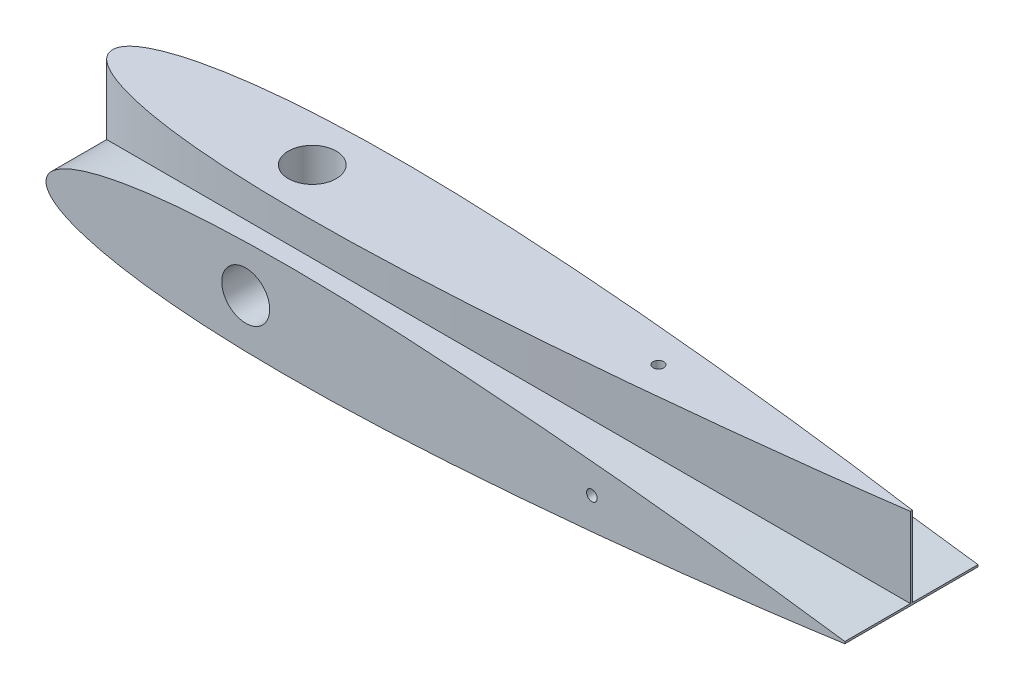
from build123d import *

# Parameters (mm, degrees)
BOSS_EXTRUDE1_DEPTH = 50
BOSS_EXTRUDE2_DEPTH = 30
SKETCH13_R          = 9
SKETCH13_R_2        = 2
CUT_EXTRUDE8_DEPTH  = 20
SKETCH7_R           = 9
SKETCH7_R_2         = 2
CUT_EXTRUDE7_DEPTH  = 308.408523106


with BuildPart() as part:
    # Sketch5 → Boss-Extrude1 (new body)
    with BuildSketch(Plane.XY):
        with BuildLine():
            Line((300, 0), (300, -0.756041962))
            add(Edge.make_bspline(
                [(300, 0), (299.270365927, 0.101451452), (297.234513604, 0.384525096), (293.659298238, 0.879722332), (289.111807476, 1.496325492), (284.07993306, 2.166637693), (278.750864845, 2.860281068), (273.264415139, 3.557143865), (267.704162982, 4.251255897), (262.112460178, 4.935343029), (256.505934894, 5.604502875), (250.889013227, 6.260338272), (245.266519137, 6.904162431), (239.643995458, 7.534650953), (234.021468154, 8.149444358), (228.395113675, 8.748715337), (222.763970876, 9.335595752), (217.1313214, 9.910009837), (211.500498238, 10.469522165), (205.872395515, 11.014254142), (200.245975807, 11.543525315), (194.620571747, 12.057286284), (188.996636207, 12.554608618), (183.375057998, 13.035821098), (177.756440831, 13.499125932), (172.14120509, 13.944011117), (166.530121591, 14.370618519), (160.924017172, 14.777048303), (155.323678997, 15.161942377), (149.729197986, 15.525511264), (144.14003771, 15.864726646), (138.556719148, 16.18031859), (132.981589915, 16.470311694), (127.417860753, 16.733140405), (121.867732906, 16.966833414), (116.330564521, 17.168209686), (110.804975644, 17.335641286), (105.290466593, 17.467467421), (99.789457992, 17.563066602), (94.306019377, 17.619568363), (88.844044449, 17.633103134), (83.406626568, 17.602210802), (77.996159127, 17.52213323), (72.615835045, 17.38999897), (67.269821711, 17.202368703), (61.964153383, 16.954456498), (56.707187731, 16.643956427), (51.511383659, 16.26386075), (46.394126937, 15.813066251), (41.379822078, 15.284517424), (36.501046317, 14.676778377), (31.804123982, 13.988399992), (27.351032213, 13.226209768), (23.219856049, 12.405271964), (19.487073369, 11.542891407), (16.202520011, 10.667189849), (13.373277604, 9.797620045), (10.968887473, 8.955995793), (8.94540731, 8.14451492), (7.251043844, 7.369385019), (5.829725371, 6.632993767), (4.631317476, 5.92296277), (3.611785056, 5.228803878), (2.735410361, 4.548887725), (1.989717136, 3.872132171), (1.37401174, 3.192436679), (0.884398863, 2.513081734), (0.512653331, 1.842321526), (0.243842413, 1.188524902), (0.06906583, 0.553066625), (-0.020161024, -0.069022816), (-0.020161024, -0.687019146), (0.06906583, -1.309108586), (0.243842413, -1.944566864), (0.512653331, -2.598363488), (0.884398863, -3.269123696), (1.37401174, -3.948478641), (1.989717136, -4.628174133), (2.735410361, -5.304929687), (3.611785056, -5.98484584), (4.631317476, -6.679004732), (5.829725371, -7.38903573), (7.251043845, -8.125426978), (8.945407307, -8.900556895), (10.968887484, -9.712037691), (13.373277554, -10.55366231), (16.202520248, -11.423230391), (19.487072279, -12.298939898), (23.219860895, -13.161284893), (27.350994941, -13.982372213), (31.804189553, -14.743931684), (36.501009866, -15.432962661), (41.379828218, -16.040519171), (46.394125242, -16.569119316), (51.511384123, -17.019899669), (56.707187605, -17.399999218), (61.964153418, -17.710498235), (67.269821701, -17.958410726), (72.615835048, -18.146040916), (77.996159127, -18.278175196), (83.406626568, -18.358252762), (88.844044449, -18.389145096), (94.306019377, -18.375610325), (99.789457992, -18.319108564), (105.290466593, -18.223509383), (110.804975644, -18.091683248), (116.330564521, -17.924251648), (121.867732906, -17.722875376), (127.417860753, -17.489182366), (132.981589915, -17.226353656), (138.556719148, -16.936360552), (144.14003771, -16.620768608), (149.729197986, -16.281553226), (155.323678997, -15.917984339), (160.924017172, -15.533090265), (166.530121591, -15.126660481), (172.14120509, -14.700053079), (177.756440831, -14.255167894), (183.375057998, -13.79186306), (188.996636207, -13.31065058), (194.620571747, -12.813328246), (200.245975807, -12.299567277), (205.872395515, -11.770296104), (211.500498238, -11.225564127), (217.1313214, -10.666051799), (222.763970876, -10.091637714), (228.395113675, -9.504757299), (234.021468154, -8.90548632), (239.643995458, -8.290692915), (245.266519137, -7.660204393), (250.889013227, -7.016380234), (256.505934894, -6.360544837), (262.112460178, -5.691384991), (267.704162982, -5.007297859), (273.264415139, -4.313185827), (278.750864845, -3.61632303), (284.07993306, -2.922679655), (289.111807476, -2.252367454), (293.659298238, -1.635764294), (297.234513604, -1.140567058), (299.270365927, -0.857493414), (300, -0.756041962)],
                knots=[0, 0, 0, 0, 0.003612221, 0.010078953, 0.017698618, 0.026115111, 0.034970966, 0.04405038, 0.05323433, 0.06244757, 0.071673993, 0.080921319, 0.090177538, 0.099424342, 0.108664441, 0.117912199, 0.127169502, 0.136426595, 0.145675426, 0.154916495, 0.164153237, 0.173386649, 0.182615736, 0.191838089, 0.201053134, 0.210260393, 0.219458942, 0.228646747, 0.237822316, 0.246985224, 0.256137384, 0.265279416, 0.27440695, 0.283512193, 0.292591781, 0.301646285, 0.310681793, 0.319699068, 0.32869452, 0.33766016, 0.346588583, 0.355477412, 0.364322937, 0.373121614, 0.381867635, 0.390553005, 0.399166026, 0.407689628, 0.416098119, 0.424354887, 0.432412429, 0.440204728, 0.447630505, 0.454563638, 0.460855379, 0.466413319, 0.47122861, 0.475365774, 0.47890126, 0.481915077, 0.484498872, 0.486747127, 0.488741252, 0.490543179, 0.492182104, 0.493672831, 0.495031908, 0.49627906, 0.497424737, 0.498490166, 0.499502758, 0.500497254, 0.501509846, 0.502575275, 0.503720952, 0.504968104, 0.506327181, 0.507817908, 0.509456832, 0.51125876, 0.513252884, 0.51550114, 0.518084934, 0.521098752, 0.524634237, 0.528771401, 0.533586692, 0.539144632, 0.545436374, 0.552369506, 0.5597952, 0.567587571, 0.575645113, 0.583901881, 0.592310372, 0.600833974, 0.609446995, 0.618132365, 0.626878386, 0.635677063, 0.644522588, 0.653411417, 0.66233984, 0.67130548, 0.680300932, 0.689318207, 0.698353715, 0.707408219, 0.716487807, 0.72559305, 0.734720584, 0.743862616, 0.753014776, 0.762177684, 0.771353253, 0.780541058, 0.789739607, 0.798946866, 0.808161911, 0.817384264, 0.826613351, 0.835846763, 0.845083505, 0.854324574, 0.863573405, 0.872830498, 0.882087801, 0.891335559, 0.900575658, 0.909822462, 0.919078681, 0.928326007, 0.93755243, 0.94676567, 0.95594962, 0.965029034, 0.973884889, 0.982301382, 0.989921047, 0.996387779, 1, 1, 1, 1], degree=3))
        make_face()
    extrude(amount=BOSS_EXTRUDE1_DEPTH)

    # Sketch10 → Boss-Extrude2 (add)
    with BuildSketch(Plane(origin=(0, 0, 0), x_dir=(1, 0, 0), z_dir=(0, 1, 0))):
        with BuildLine():
            Line((300, -24.621999914), (300, -25.378000086))
            add(Edge.make_bspline(
                [(300, -24.621999914), (299.270406258, -24.52055407), (297.234666467, -24.237496073), (293.659648722, -23.742326209), (289.112409325, -23.125757132), (284.080813047, -22.455481982), (278.752039398, -21.761876949), (273.265892957, -21.065052672), (267.705948145, -20.370979007), (262.114554424, -19.686929688), (256.508339042, -19.01780683), (250.891727853, -18.362007685), (245.269544548, -17.718219113), (239.647331656, -17.087765441), (234.025115138, -16.473006019), (228.399071658, -15.873768166), (222.768240123, -15.28692019), (217.135901993, -14.712537856), (211.505390076, -14.153056455), (205.877598449, -13.608354589), (200.251489743, -13.079112671), (194.626396629, -12.565380101), (189.002771954, -12.068085257), (183.381504479, -11.586899375), (177.763197883, -11.123620151), (172.148272526, -10.678759557), (166.537499181, -10.252175736), (160.931704642, -9.845768418), (155.331676028, -9.460895619), (149.737504253, -9.097346828), (144.148652919, -8.758150196), (138.565642978, -8.442575697), (132.990821912, -8.152598622), (127.427400287, -7.889784439), (121.877579225, -7.656104347), (116.340716908, -7.454739206), (110.81543346, -7.287316861), (105.301229225, -7.155498013), (99.800524694, -7.059904117), (94.317389178, -7.003405478), (88.855716162, -6.989871456), (83.418598836, -7.020762081), (78.008430461, -7.100835226), (72.628403778, -7.232962182), (67.282685946, -7.420582078), (61.977310891, -7.668480579), (56.72063582, -7.978963487), (51.525118947, -8.359038155), (46.408145083, -8.809807736), (41.394117392, -9.338327347), (36.515611307, -9.946032801), (31.818948595, -10.634373136), (27.366102973, -11.39652123), (23.235155161, -12.217413656), (19.502578811, -13.079746544), (16.218207008, -13.955399698), (13.389120989, -14.824921436), (10.984863761, -15.666499167), (8.961495446, -16.477935185), (7.267225637, -17.253022241), (5.845985727, -17.989372788), (4.647644075, -18.699364538), (3.62816801, -19.39348506), (2.751841757, -20.073363631), (2.006189751, -20.750081777), (1.390518388, -21.429739698), (0.900932575, -22.109057092), (0.52920759, -22.779780223), (0.260411531, -23.433540709), (0.085644609, -24.068963861), (-0.003577313, -24.691018915), (-0.003577313, -25.308981085), (0.085644609, -25.931036139), (0.260411531, -26.566459291), (0.52920759, -27.220219777), (0.900932575, -27.890942908), (1.390518388, -28.570260302), (2.006189751, -29.249918223), (2.751841757, -29.926636369), (3.62816801, -30.60651494), (4.647644075, -31.300635462), (5.845985727, -32.010627213), (7.267225637, -32.746977757), (8.961495444, -33.522064829), (10.984863772, -34.333500769), (13.389120938, -35.175078867), (16.218207245, -36.044598882), (19.502577721, -36.920259984), (23.235160006, -37.782557313), (27.366065703, -38.603599247), (31.819014163, -39.365116623), (36.515574857, -40.054109513), (41.394123531, -40.66163244), (46.408143388, -41.190203367), (51.525119412, -41.640958803), (56.720635693, -42.021037342), (61.977310926, -42.331519196), (67.282685937, -42.579417983), (72.628403781, -42.767037802), (78.008430461, -42.899164778), (83.418598837, -42.979237918), (88.855716162, -43.010128544), (94.317389178, -42.996594522), (99.800524694, -42.940095883), (105.301229225, -42.844501987), (110.81543346, -42.712683139), (116.340716908, -42.545260794), (121.877579225, -42.343895653), (127.427400287, -42.110215561), (132.990821912, -41.847401378), (138.565642978, -41.557424303), (144.148652919, -41.241849804), (149.737504253, -40.902653172), (155.331676028, -40.539104381), (160.931704642, -40.154231582), (166.537499181, -39.747824264), (172.148272526, -39.321240443), (177.763197883, -38.876379849), (183.381504479, -38.413100625), (189.002771954, -37.931914743), (194.626396629, -37.434619899), (200.251489743, -36.920887329), (205.877598449, -36.391645411), (211.505390076, -35.846943545), (217.135901993, -35.287462144), (222.768240123, -34.71307981), (228.399071658, -34.126231834), (234.025115138, -33.526993981), (239.647331656, -32.912234559), (245.269544548, -32.281780887), (250.891727853, -31.637992315), (256.508339042, -30.98219317), (262.114554424, -30.313070312), (267.705948145, -29.629020993), (273.265892957, -28.934947328), (278.752039398, -28.238123051), (284.080813047, -27.544518018), (289.112409325, -26.874242868), (293.659648722, -26.257673791), (297.234666467, -25.762503927), (299.270406258, -25.47944593), (300, -25.378000086)],
                knots=[0, 0, 0, 0, 0.003612221, 0.010078953, 0.017698618, 0.026115111, 0.034970966, 0.04405038, 0.05323433, 0.06244757, 0.071673993, 0.080921319, 0.090177538, 0.099424342, 0.108664441, 0.117912199, 0.127169502, 0.136426595, 0.145675426, 0.154916495, 0.164153237, 0.173386649, 0.182615736, 0.191838089, 0.201053134, 0.210260393, 0.219458942, 0.228646747, 0.237822316, 0.246985224, 0.256137384, 0.265279416, 0.27440695, 0.283512193, 0.292591781, 0.301646285, 0.310681793, 0.319699068, 0.32869452, 0.33766016, 0.346588583, 0.355477412, 0.364322937, 0.373121614, 0.381867635, 0.390553005, 0.399166026, 0.407689628, 0.416098119, 0.424354887, 0.432412429, 0.440204728, 0.447630505, 0.454563638, 0.460855379, 0.466413319, 0.47122861, 0.475365774, 0.47890126, 0.481915077, 0.484498872, 0.486747127, 0.488741252, 0.490543179, 0.492182104, 0.493672831, 0.495031908, 0.49627906, 0.497424737, 0.498490166, 0.499502758, 0.500497254, 0.501509846, 0.502575275, 0.503720952, 0.504968104, 0.506327181, 0.507817908, 0.509456832, 0.51125876, 0.513252884, 0.51550114, 0.518084934, 0.521098752, 0.524634237, 0.528771401, 0.533586692, 0.539144632, 0.545436374, 0.552369506, 0.5597952, 0.567587571, 0.575645113, 0.583901881, 0.592310372, 0.600833974, 0.609446995, 0.618132365, 0.626878386, 0.635677063, 0.644522588, 0.653411417, 0.66233984, 0.67130548, 0.680300932, 0.689318207, 0.698353715, 0.707408219, 0.716487807, 0.72559305, 0.734720584, 0.743862616, 0.753014776, 0.762177684, 0.771353253, 0.780541058, 0.789739607, 0.798946866, 0.808161911, 0.817384264, 0.826613351, 0.835846763, 0.845083505, 0.854324574, 0.863573405, 0.872830498, 0.882087801, 0.891335559, 0.900575658, 0.909822462, 0.919078681, 0.928326007, 0.93755243, 0.94676567, 0.95594962, 0.965029034, 0.973884889, 0.982301382, 0.989921047, 0.996387779, 1, 1, 1, 1], degree=3))
        make_face()
    extrude(amount=BOSS_EXTRUDE2_DEPTH)

    # Sketch13 → Cut-Extrude8 (cut)
    with BuildSketch(Plane(origin=(0, 30, 0), x_dir=(1, 0, 0), z_dir=(0, 1, 0))):
        with Locations((74.983416487, -25)):
            Circle(SKETCH13_R)
        with Locations((204.983416487, -25)):
            Circle(SKETCH13_R_2)
    extrude(amount=-CUT_EXTRUDE8_DEPTH, mode=Mode.SUBTRACT)

    # Sketch7 → Cut-Extrude7 (cut, through all)
    with BuildSketch(Plane.XY.offset(60)):
        with Locations((75, 0)):
            Circle(SKETCH7_R)
        with Locations((205, 0)):
            Circle(SKETCH7_R_2)
    extrude(amount=-CUT_EXTRUDE7_DEPTH, mode=Mode.SUBTRACT)


solid = part.part
